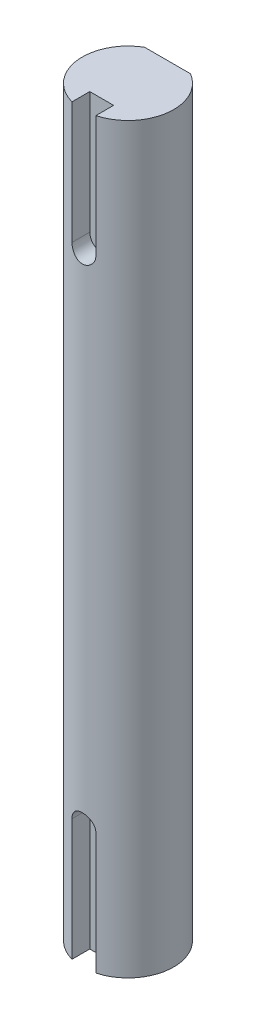
from build123d import *

# Parameters (mm, degrees)
BOSS_EXTRUDE1_DEPTH      = 38.735
BOSS_EXTRUDE1_DEPTH_BACK = 38.735
CUT_EXTRUDE4_DEPTH       = 40.625695711


with BuildPart() as part:
    # Sketch1 → Boss-Extrude1 (new, two sides: drawn at the far end of the back side and taken through both)
    with BuildSketch(Plane(origin=(0, 0, 0), x_dir=(1, 0, 0), z_dir=(0, 1, 0)).offset(-BOSS_EXTRUDE1_DEPTH_BACK)):
        with BuildLine():
            Line((2.3876, 4.120773288), (-2.3876, 4.120773288))
            ThreePointArc((-2.3876, 4.120773288), (-2.378072881, -4.126278665), (4.7625, 0))
            ThreePointArc((4.7625, 0), (4.126278665, 2.378072881), (2.3876, 4.120773288))
        make_face()
    extrude(amount=BOSS_EXTRUDE1_DEPTH + BOSS_EXTRUDE1_DEPTH_BACK)

    # Sketch4 → Cut-Extrude4 (cut, through all)
    with BuildSketch(Plane.XY.offset(2.7432)):
        with BuildLine():
            Line((1.2446, 38.735), (-1.2446, 38.735))
            Line((-1.2446, 38.735), (-1.2446, 26.035))
            ThreePointArc((-1.2446, 26.035), (0, 24.7904), (1.2446, 26.035))
            Line((1.2446, 26.035), (1.2446, 38.735))
        make_face()
        with BuildLine():
            Line((-1.2446, -26.035), (-1.2446, -38.735))
            Line((-1.2446, -38.735), (1.2446, -38.735))
            Line((1.2446, -38.735), (1.2446, -26.035))
            ThreePointArc((1.2446, -26.035), (0, -24.7904), (-1.2446, -26.035))
        make_face()
    extrude(amount=CUT_EXTRUDE4_DEPTH, mode=Mode.SUBTRACT)


solid = part.part
